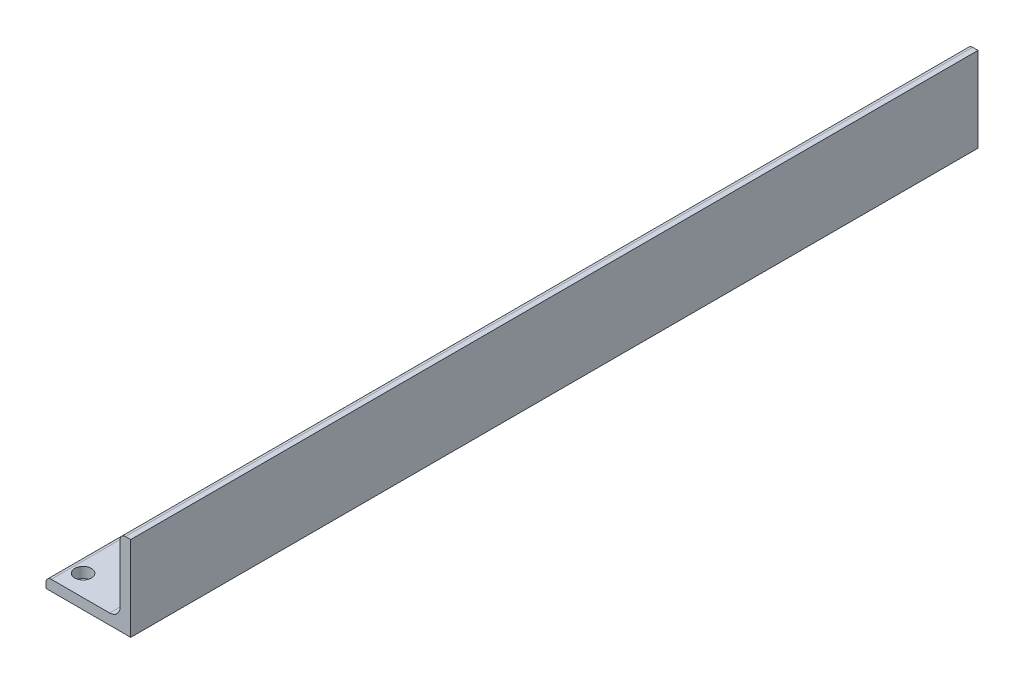
from build123d import *

# Parameters (mm, degrees)
BOSS_EXTRUDE1_DEPTH = 304.8
SKETCH7_W           = 25.4
SKETCH7_H           = 355.6
CUT_EXTRUDE1_DEPTH  = 254
SKETCH3_R           = 2.5
CUT_EXTRUDE2_DEPTH  = 254


with BuildPart() as part:
    # Sketch2 → Boss-Extrude1 (new, symmetric)
    with BuildSketch(Plane.XY):
        with BuildLine():
            Line((-12.7, -12.7), (12.7, -12.7))
            Line((12.7, -12.7), (12.7, 12.7))
            Line((12.7, 12.7), (11.1125, 12.7))
            ThreePointArc((11.1125, 12.7), (9.989967985, 12.235032015), (9.525, 11.1125))
            Line((9.525, 11.1125), (9.525, -6.35))
            ThreePointArc((9.525, -6.35), (8.59506403, -8.59506403), (6.35, -9.525))
            Line((6.35, -9.525), (-11.1125, -9.525))
            ThreePointArc((-11.1125, -9.525), (-12.235032015, -9.989967985), (-12.7, -11.1125))
            Line((-12.7, -11.1125), (-12.7, -12.7))
        make_face()
    extrude(amount=BOSS_EXTRUDE1_DEPTH, both=True)

    # Sketch7 → Cut-Extrude1 (cut)
    with BuildSketch(Plane.XZ.offset(12.7)):
        with Locations((0, 127)):
            Rectangle(SKETCH7_W, SKETCH7_H)
    extrude(amount=-CUT_EXTRUDE1_DEPTH, mode=Mode.SUBTRACT)

    # Sketch3 → Cut-Extrude2 (cut)
    with BuildSketch(Plane(origin=(0, 0, 0), x_dir=(1, 0, 0), z_dir=(0, 1, 0))):
        with Locations((4.7625, 273.05)):
            Circle(SKETCH3_R)
        with Locations((4.7625, 234.95)):
            Circle(SKETCH3_R)
        with Locations((4.7625, 196.85)):
            Circle(SKETCH3_R)
        with Locations((4.7625, 158.75)):
            Circle(SKETCH3_R)
        with Locations((4.7625, 120.65)):
            Circle(SKETCH3_R)
        with Locations((4.7625, 82.55)):
            Circle(SKETCH3_R)
        with Locations((4.7625, 44.45)):
            Circle(SKETCH3_R)
        with Locations((4.7625, 6.35)):
            Circle(SKETCH3_R)
        with Locations((4.7625, -31.75)):
            Circle(SKETCH3_R)
        with Locations((4.7625, -69.85)):
            Circle(SKETCH3_R)
        with Locations((4.7625, -107.95)):
            Circle(SKETCH3_R)
        with Locations((-7.9375, -107.95)):
            Circle(SKETCH3_R)
        with Locations((-7.9375, -69.85)):
            Circle(SKETCH3_R)
        with Locations((-7.9375, -31.75)):
            Circle(SKETCH3_R)
        with Locations((-7.9375, 6.35)):
            Circle(SKETCH3_R)
        with Locations((-7.9375, 44.45)):
            Circle(SKETCH3_R)
        with Locations((-7.9375, 82.55)):
            Circle(SKETCH3_R)
        with Locations((-7.9375, 120.65)):
            Circle(SKETCH3_R)
        with Locations((-7.9375, 158.75)):
            Circle(SKETCH3_R)
        with Locations((-7.9375, 196.85)):
            Circle(SKETCH3_R)
        with Locations((-7.9375, 234.95)):
            Circle(SKETCH3_R)
        with Locations((-7.9375, 273.05)):
            Circle(SKETCH3_R)
        with Locations((-7.9375, 298.45)):
            Circle(SKETCH3_R)
        with Locations((-7.9375, 57.15)):
            Circle(SKETCH3_R)
    extrude(amount=-CUT_EXTRUDE2_DEPTH, mode=Mode.SUBTRACT)


solid = part.part
